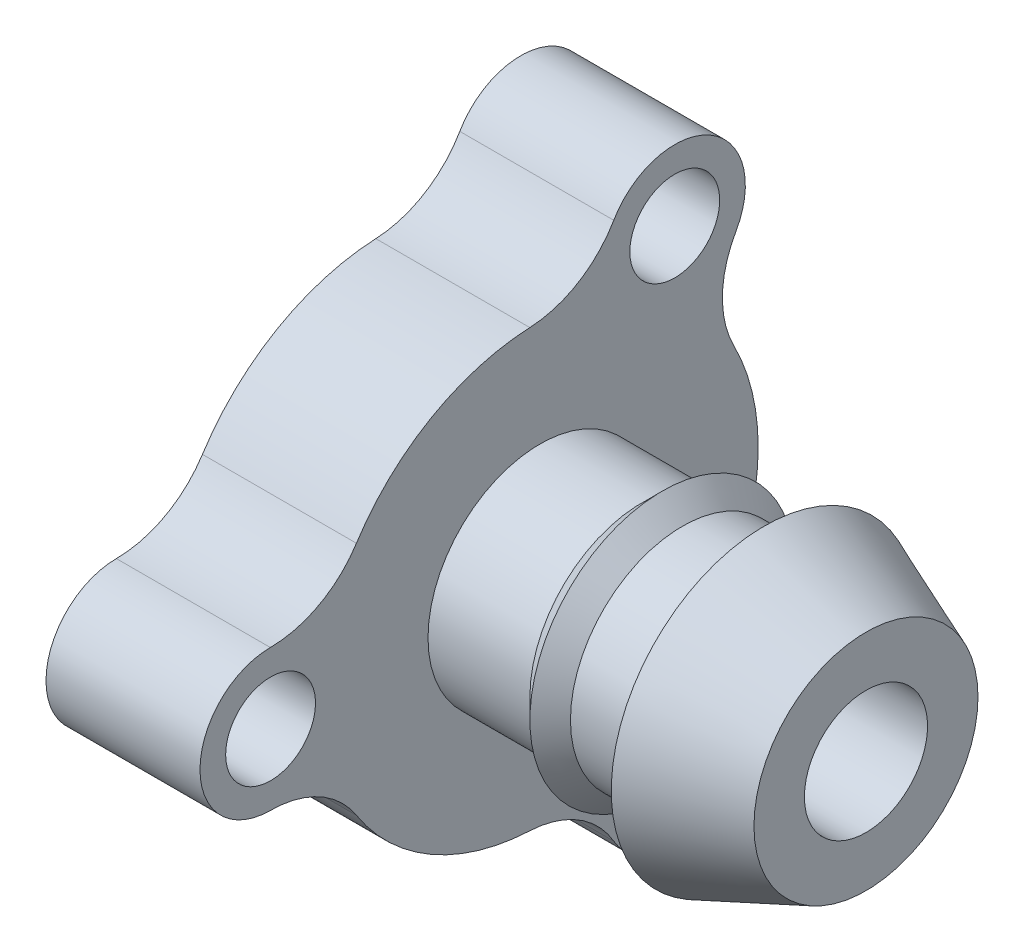
from build123d import *

# Parameters (mm, degrees)
SKETCH4_R            = 8.5
SKETCH4_R_2          = 4.365
SKETCH4_R_3          = 3.8
SKETCH4_R_4          = 2.4
BOSS_EXTRUDE1_DEPTH  = 2
BOSS_EXTRUDE2_START  = 2
SKETCH4_3_R          = 8.5
SKETCH4_3_R_2        = 4.365
BOSS_EXTRUDE2_DEPTH  = 4
SKETCH4_4_R          = 2.4
CUT_EXTRUDE2_DEPTH   = 18.486852204
CUT_SWEEP1_PROFILE_R = 0.889
SKETCH14_R           = 2.75
SKETCH14_R_2         = 1.75
BOSS_EXTRUDE3_DEPTH  = 6
FILLET3_R            = 4
CHAMFER1_SIZE        = 1


with BuildPart() as part:
    # Sketch1 → Revolve1 (revolve)
    with BuildSketch(Plane(origin=(0, 0, 0), x_dir=(1, 0, 0), z_dir=(0, 1, 0))):
        Polygon((0, 0), (-12.7, 0), (-12.7, 4.365), (-8.73, 4.365), (-7.94, 5.155), (-7.15, 4.365), (-3.97, 4.365), (-3.97, 5.955), (0, 4.365), align=None)
    revolve(axis=Axis((0, 0, 0), (-1, 0, 0)))

    # Sketch4 → Boss-Extrude1 (add)
    # profile 1 of 3: a face of its own
    with BuildSketch(Plane.ZY.offset(12.7)):
        Circle(SKETCH4_R)
        with Locations(Location((0, 0, 0), (0, 0, 180))):
            Circle(SKETCH4_R_2, mode=Mode.SUBTRACT)
    # profile 2 of 3: a face of its own
    with BuildSketch(Plane.ZY.offset(12.7)):
        with Locations(Location((0, 0, 0), (0, 0, 180))):
            Circle(SKETCH4_R_2)
        Circle(SKETCH4_R_3, mode=Mode.SUBTRACT)
    # profile 3 of 3: a face of its own
    with BuildSketch(Plane.ZY.offset(12.7)):
        Circle(SKETCH4_R_3)
        Circle(SKETCH4_R_4, mode=Mode.SUBTRACT)
    extrude(amount=BOSS_EXTRUDE1_DEPTH)

    # Sketch4<3> → Boss-Extrude2 (add)
    with BuildSketch(Plane.ZY.offset(12.7).offset(BOSS_EXTRUDE2_START)):
        Circle(SKETCH4_3_R)
        with Locations(Location((0, 0, 0), (0, 0, 180))):
            Circle(SKETCH4_3_R_2, mode=Mode.SUBTRACT)
    extrude(amount=BOSS_EXTRUDE2_DEPTH)

    # Sketch4<4> → Cut-Extrude2 (cut, through all)
    with BuildSketch(Plane.ZY.offset(12.7)):
        Circle(SKETCH4_4_R)
    extrude(amount=-CUT_EXTRUDE2_DEPTH, mode=Mode.SUBTRACT)

    # Cut-Sweep1: sweep along a path in Sketch5
    with BuildLine(Plane.ZY.offset(18.7)) as cut_sweep1_path:
        CenterArc((0, 0), 6.082351302, 0, 360)
    # Cut-Sweep1 profile (on start of the path) → Cut-Sweep1 (sweep, cut)
    with BuildSketch(Plane(origin=(-18.7, 0, 6.082351302), x_dir=(0, 0, 1), z_dir=(0, 1, 0))):
        Circle(CUT_SWEEP1_PROFILE_R)
    sweep(path=cut_sweep1_path.line, mode=Mode.SUBTRACT)

    # Sketch14 → Boss-Extrude3 (add)
    # profile 1 of 3: a face of its own
    with BuildSketch(Plane.ZY.offset(18.7)):
        with Locations((10.5, 0)):
            Circle(SKETCH14_R)
        with Locations((10.5, 0)):
            Circle(SKETCH14_R_2, mode=Mode.SUBTRACT)
    # profile 2 of 3: a face of its own
    with BuildSketch(Plane.ZY.offset(18.7)):
        with Locations((-5.25, -9.09326674)):
            Circle(SKETCH14_R)
        with Locations((-5.25, -9.09326674)):
            Circle(SKETCH14_R_2, mode=Mode.SUBTRACT)
    # profile 3 of 3: a face of its own
    with BuildSketch(Plane.ZY.offset(18.7)):
        with Locations((-5.25, 9.09326674)):
            Circle(SKETCH14_R)
        with Locations((-5.25, 9.09326674)):
            Circle(SKETCH14_R_2, mode=Mode.SUBTRACT)
    extrude(amount=-BOSS_EXTRUDE3_DEPTH)

    # Fillet3
    # the kernel refuses this fillet: 4 mm, written as the material it adds along each edge
    with BuildSketch(Plane(origin=(-18.7, 8.059160345, -2.701839101), x_dir=(0, 0.13787930988752692, 0.9904490375102291), z_dir=(1, 0, 0))) as fillet3_piece_1:
        with BuildLine():
            CenterArc((3.866081399, -3.931630738), FILLET3_R, 100.608613334, 57.139697136)
            ThreePointArc((0.163964046, -2.4169271), (0.362452033, -1.189436498), (0, 0))
            ThreePointArc((0, 0), (1.564842471, -0.145284682), (3.129684942, 0))
        make_face()
    extrude(amount=6)
    with BuildSketch(Plane(origin=(-18.7, 6.369441471, -5.628518041), x_dir=(0, 0.559831667079214, -0.8286063628378122), z_dir=(1, 0, 0)), Plane(origin=(-18.7, -8.059160345, -2.701839101), x_dir=(0, -0.9975099934945784, -0.07052526411468515), z_dir=(1, 0, 0))) as fillet3_piece_2:
        with BuildLine():
            CenterArc((4.184287724, -3.591105941), FILLET3_R, 116.132681907, 57.139697136)
            ThreePointArc((0.211830564, -3.12250791), (0.250866796, -1.551420461), (0, 0))
            ThreePointArc((0, 0), (1.211241183, -0.281114665), (2.422482367, 0))
        make_face()
    extrude(amount=6)
    with BuildSketch(Plane(origin=(-18.7, -6.369441471, -5.628518041), x_dir=(0, -0.5598316670792142, -0.8286063628378122), z_dir=(1, 0, 0)), Plane(origin=(-18.7, -1.689718874, 8.330357143), x_dir=(0, -0.43767832641536075, 0.8991316269524996), z_dir=(1, 0, 0))) as fillet3_piece_3:
        with BuildLine():
            CenterArc((4.184287724, 3.591105941), FILLET3_R, 186.727620957, 57.139697136)
            ThreePointArc((0.211830564, 3.12250791), (0.250866796, 1.551420461), (0, 0))
            ThreePointArc((0, 0), (1.211241183, 0.281114665), (2.422482367, 0))
        make_face()
    extrude(amount=6)
    with BuildSketch(Plane(origin=(-18.7, 1.689718874, 8.330357143), x_dir=(0, 0.9266936825814681, -0.3758175337362501), z_dir=(1, 0, 0))) as fillet3_piece_4:
        with BuildLine():
            CenterArc((3.866081399, 3.931630738), FILLET3_R, 202.25168953, 57.139697136)
            ThreePointArc((0.163964046, 2.4169271), (0.362452033, 1.189436498), (0, 0))
            ThreePointArc((0, 0), (1.564842471, 0.145284682), (3.129684942, 0))
        make_face()
    extrude(amount=6)

    # Chamfer1
    chamfer1_edges = [part.edges().sort_by_distance(p)[0] for p in [
        (-14.7, 0, -2.4),
    ]]
    chamfer(chamfer1_edges, length=CHAMFER1_SIZE)


solid = part.part
